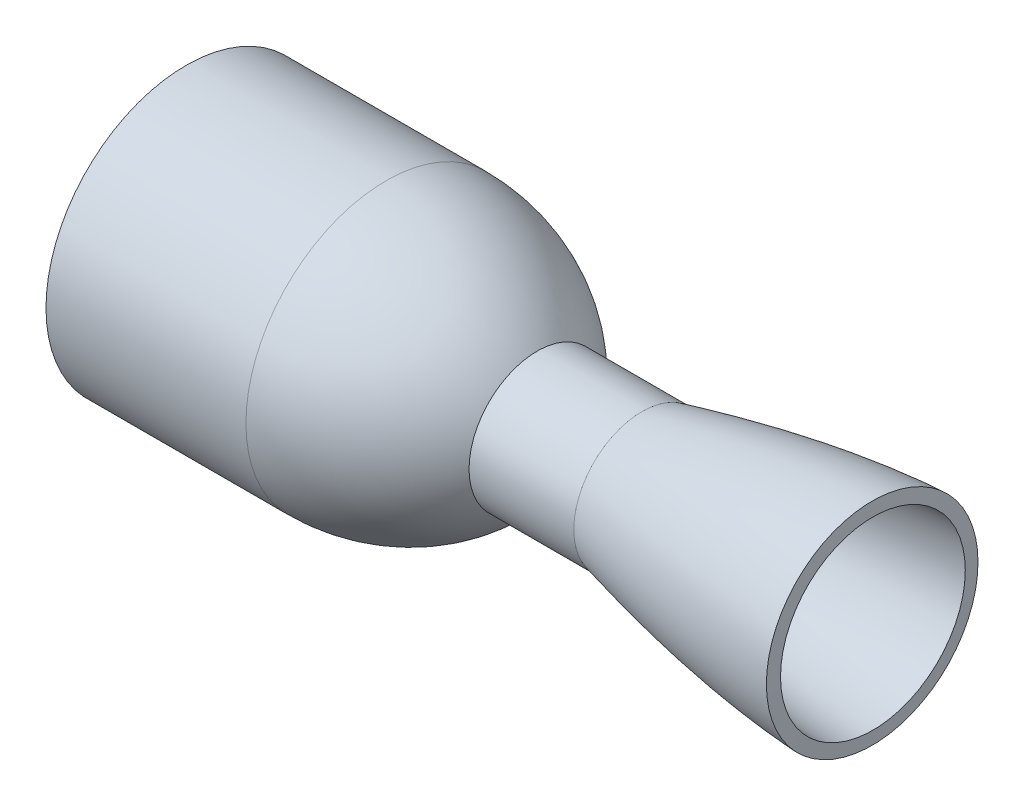
from build123d import *


with BuildPart() as part:
    # Sketch1 → Revolve1 (revolve)
    with BuildSketch(Plane.XY):
        with BuildLine():
            Line((0, 57.319), (85.97, 57.319))
            ThreePointArc((85.97, 57.319), (126.938644839, 50.342719691), (160.657513694, 26.05))
            Line((160.657513694, 26.05), (216.937128562, 26.05))
            add(Edge.make_bspline(
                [(216.937128562, 26.05), (277.434217407, 41.187862776), (324.51, 43.655)],
                knots=[0, 0, 0, 1, 1, 1], degree=2))
            Line((324.51, 43.655), (324.177666678, 49.996297546))
            add(Edge.make_bspline(
                [(215.39572493, 32.210079126), (217.915026966, 32.840470592), (222.988604796, 34.08557511), (230.44044404, 35.840220845), (237.804430354, 37.499481119), (247.481010217, 39.57832063), (259.322097096, 41.92931775), (273.121465236, 44.353106582), (286.511935077, 46.37914517), (299.497456943, 48.006866312), (309.972242226, 49.030173171), (318.167062384, 49.649598565), (322.16494846, 49.890815454), (324.177666678, 49.996297546)],
                knots=[0.493670927, 0.493670927, 0.493670927, 0.493670927, 0.493805184, 0.493939441, 0.494073698, 0.494207954, 0.494476468, 0.494744982, 0.495013495, 0.495282009, 0.495550522, 0.495684779, 0.495819036, 0.495819036, 0.495819036, 0.495819036], degree=3))
            Line((215.39572493, 32.210079126), (165.889203053, 32.210079126))
            ThreePointArc((165.889203053, 32.210079126), (134.022607471, 57.275537425), (94.475795207, 66.209))
            Line((94.475795207, 66.209), (0, 66.209))
            Line((0, 66.209), (0, 57.319))
        make_face()
    revolve(axis=Axis((0, 0, 0), (1, 0, 0)))


solid = part.part
